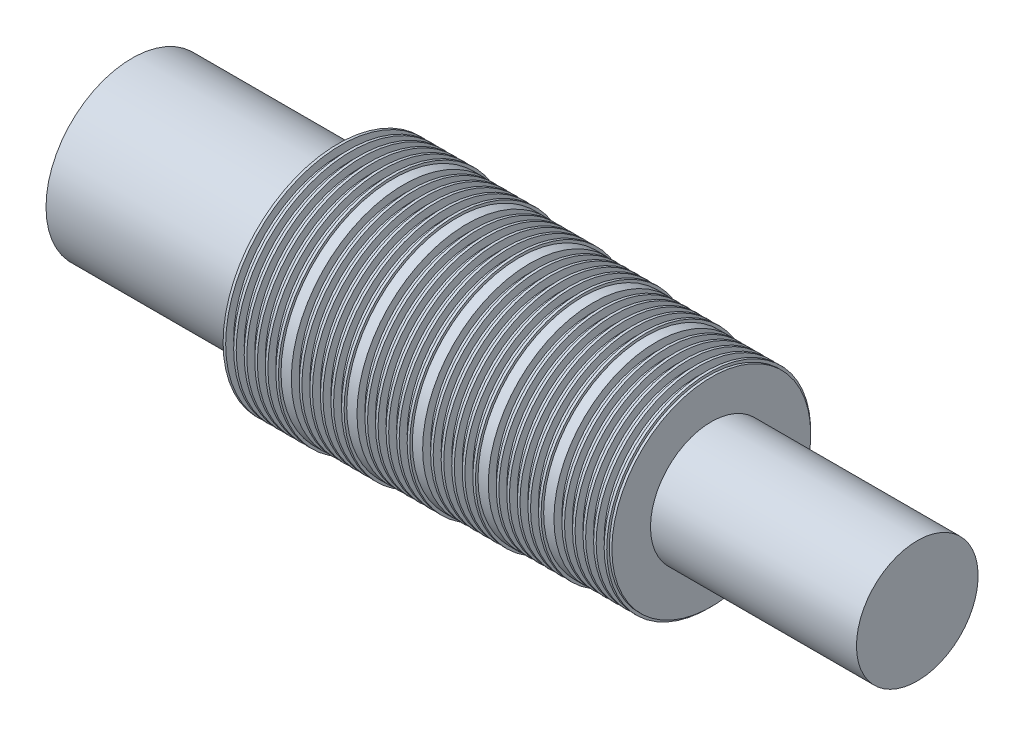
from build123d import *


with BuildPart() as part:
    # Sketch1 → Revolve1 (revolve)
    with BuildSketch(Plane.XY):
        Polygon((20.574, 11.333988), (20.574, 10.546588), (21.3614, 10.546588), (21.3614, 11.333988), (21.6154, 11.333988), (21.6154, 10.546588), (22.4028, 10.546588), (22.4028, 11.333988), (22.6568, 11.333988), (22.6568, 10.546588), (23.4442, 10.546588), (23.4442, 11.333988), (23.6982, 11.333988), (23.6982, 10.546588), (24.4856, 10.546588), (24.4856, 11.333988), (24.7396, 11.333988), (24.7396, 10.546588), (25.527, 10.546588), (25.527, 11.333988), (25.781, 11.333988), (25.781, 11.079988), (26.797, 11.079988), (26.797, 10.292588), (27.5844, 10.292588), (27.5844, 11.079988), (27.8384, 11.079988), (27.8384, 10.292588), (28.6258, 10.292588), (28.6258, 11.079988), (28.8798, 11.079988), (28.8798, 10.292588), (29.6672, 10.292588), (29.6672, 11.079988), (29.9212, 11.079988), (29.9212, 10.292588), (30.7086, 10.292588), (30.7086, 11.079988), (30.9626, 11.079988), (30.9626, 10.292588), (31.75, 10.292588), (31.75, 11.079988), (32.004, 11.079988), (32.004, 10.825988), (33.02, 10.825988), (33.02, 10.038588), (33.8074, 10.038588), (33.8074, 10.825988), (34.0614, 10.825988), (34.0614, 10.038588), (34.8488, 10.038588), (34.8488, 10.825988), (35.1028, 10.825988), (35.1028, 10.038588), (35.8902, 10.038588), (35.8902, 10.825988), (36.1442, 10.825988), (36.1442, 10.038588), (36.9316, 10.038588), (36.9316, 10.825988), (37.1856, 10.825988), (37.1856, 10.038588), (37.973, 10.038588), (37.973, 10.825988), (38.227, 10.825988), (38.227, 10.571988), (39.243, 10.571988), (39.243, 9.784588), (40.0304, 9.784588), (40.0304, 10.571988), (40.2844, 10.571988), (40.2844, 9.784588), (41.0718, 9.784588), (41.0718, 10.571988), (41.3258, 10.571988), (41.3258, 9.784588), (42.1132, 9.784588), (42.1132, 10.571988), (42.3672, 10.571988), (42.3672, 9.784588), (43.1546, 9.784588), (43.1546, 10.571988), (43.4086, 10.571988), (43.4086, 9.784588), (44.196, 9.784588), (44.196, 10.571988), (44.45, 10.571988), (44.45, 10.317988), (45.466, 10.317988), (45.466, 9.530588), (46.2534, 9.530588), (46.2534, 10.317988), (46.5074, 10.317988), (46.5074, 9.530588), (47.2948, 9.530588), (47.2948, 10.317988), (47.5488, 10.317988), (47.5488, 9.530588), (48.3362, 9.530588), (48.3362, 10.317988), (48.5902, 10.317988), (48.5902, 9.530588), (49.3776, 9.530588), (49.3776, 10.317988), (49.6316, 10.317988), (49.6316, 9.530588), (50.419, 9.530588), (50.419, 10.317988), (50.673, 10.317988), (50.673, 10.063988), (51.689, 10.063988), (51.689, 9.276588), (52.4764, 9.276588), (52.4764, 10.063988), (52.7304, 10.063988), (52.7304, 9.276588), (53.5178, 9.276588), (53.5178, 10.063988), (53.7718, 10.063988), (53.7718, 9.276588), (54.5592, 9.276588), (54.5592, 10.063988), (54.8132, 10.063988), (54.8132, 9.276588), (55.6006, 9.276588), (55.6006, 10.063988), (55.8546, 10.063988), (55.8546, 9.276588), (56.642, 9.276588), (56.642, 10.063988), (56.896, 10.063988), (56.896, 9.809988), (57.15, 9.809988), (57.15, 5.999988), (77.47, 5.999988), (77.47, 0), (61.976, 0), (0, 0), (0, 8.4836), (20.32, 8.4836), (20.32, 11.333988), align=None)
    revolve(axis=Axis((0, 0, 0), (1, 0, 0)))


solid = part.part
